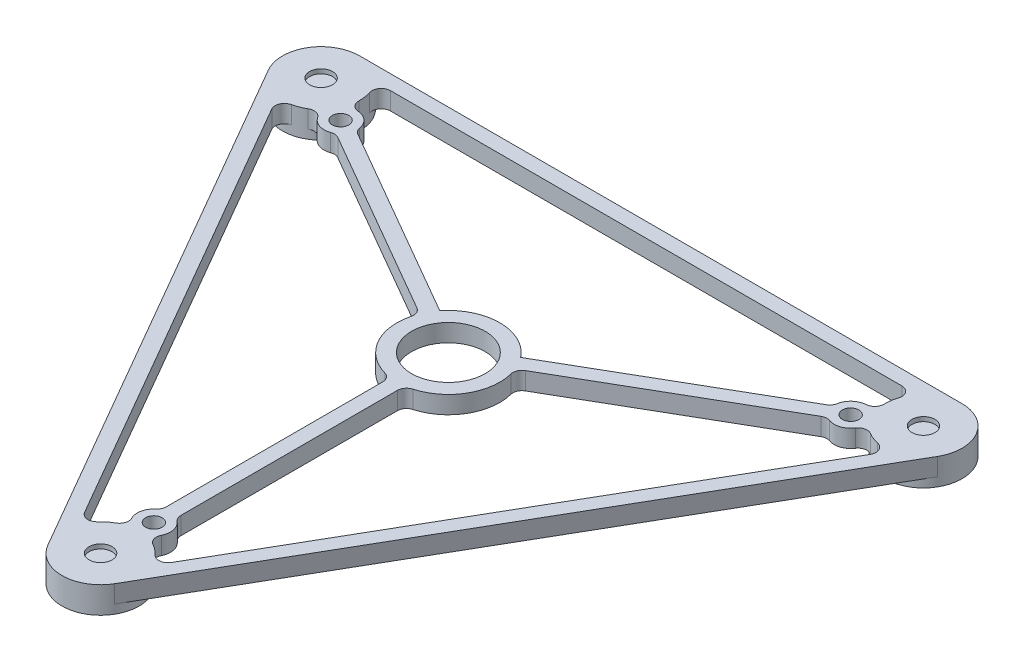
from build123d import *

# Parameters (mm, degrees)
SKETCH6_R           = 2.6
SKETCH6_R_2         = 4
BOSS_EXTRUDE4_DEPTH = 1.92
BOSS_EXTRUDE5_START = -0.96
SKETCH7_R           = 2.6
BOSS_EXTRUDE5_DEPTH = 0.96
BOSS_EXTRUDE6_START = 0.96
SKETCH8_R           = 4.2
SKETCH8_R_2         = 2.6
BOSS_EXTRUDE6_DEPTH = 0.96
CUT_EXTRUDE1_START  = -0.48
SKETCH9_R           = 1.25
CUT_EXTRUDE1_DEPTH  = 1
SKETCH15_R          = 1.8
SKETCH15_R_2        = 0.9
BOSS_EXTRUDE9_DEPTH = 1.92
SKETCH16_R          = 0.9
CUT_EXTRUDE2_DEPTH  = 110.391782763
FILLET4_R           = 1
FILLET5_R           = 1
FILLET6_R           = 1
FILLET7_R           = 1
FILLET8_R           = 1
FILLET9_R           = 1
FILLET10_R          = 1


with BuildPart() as part:
    # Sketch6 → Boss-Extrude4 (new body)
    with BuildSketch(Plane(origin=(6.205374015, -22.036704958, -3.582674358), x_dir=(-0.6546536707079775, 0, -0.7559289460184543), z_dir=(0, 1, 0))):
        with BuildLine():
            Line((-13.915641084, 5.595994683), (-78.289506975, 17.98475095))
            ThreePointArc((-78.289506975, 17.98475095), (-82.258133941, 16.609978241), (-83.051859334, 12.485660116))
            Line((-83.051859334, 12.485660116), (-61.593904038, -49.458121219))
            ThreePointArc((-61.593904038, -49.458121219), (-58.419002464, -52.207666636), (-54.450375498, -50.832893927))
            Line((-54.450375498, -50.832893927), (-11.534464904, -1.27786886))
            ThreePointArc((-11.534464904, -1.27786886), (-10.740739511, 2.846449266), (-13.915641084, 5.595994683))
        make_face()
        with BuildLine():
            Line((-61.161728639, -45.817623392), (-80.460318949, 9.892608162))
            ThreePointArc((-80.460318949, 9.892608162), (-78.390537961, 9.717948731), (-76.490180415, 10.556483435))
            Line((-76.490180415, 10.556483435), (-55.186131734, -7.893363926))
            ThreePointArc((-55.186131734, -7.893363926), (-55.764127927, -12.750109988), (-52.305655583, -16.208582332))
            Line((-52.305655583, -16.208582332), (-57.631667753, -43.883353372))
            ThreePointArc((-57.631667753, -43.883353372), (-59.643514651, -44.400046042), (-61.161728639, -45.817623392))
        make_face(mode=Mode.SUBTRACT)
        with BuildLine():
            Line((-54.138685861, -6.683877612), (-75.442734541, 11.765969748))
            ThreePointArc((-75.442734541, 11.765969748), (-74.884280071, 13.766626605), (-75.352831074, 15.790227162))
            Line((-75.352831074, 15.790227162), (-17.457060141, 4.648180851))
            ThreePointArc((-17.457060141, 4.648180851), (-18.64321014, 2.943027651), (-18.867196558, 0.878002387))
            Line((-18.867196558, 0.878002387), (-45.497257408, -8.346921293))
            ThreePointArc((-45.497257408, -8.346921293), (-49.414324781, -5.417988876), (-54.138685861, -6.683877612))
        make_face(mode=Mode.SUBTRACT)
        with BuildLine():
            ThreePointArc((-18.343473621, -0.633855505), (-16.890081194, -2.117819692), (-14.903316204, -2.723842899))
            Line((-14.903316204, -2.723842899), (-53.500496825, -47.292028142))
            ThreePointArc((-53.500496825, -47.292028142), (-54.384127815, -45.412215511), (-56.060498944, -44.185724951))
            Line((-56.060498944, -44.185724951), (-50.734486774, -16.51095391))
            ThreePointArc((-50.734486774, -16.51095391), (-46.239423208, -14.583140266), (-44.973534471, -9.858779185))
            Line((-44.973534471, -9.858779185), (-18.343473621, -0.633855505))
        make_face(mode=Mode.SUBTRACT)
        with Locations(Location((-79.083232368, 13.860432824, 0), (0, 0, 139.106605351))):
            Circle(SKETCH6_R, mode=Mode.SUBTRACT)
        with Locations(Location((-57.625277071, -48.08334851, 0), (0, 0, 139.106605351))):
            Circle(SKETCH6_R, mode=Mode.SUBTRACT)
        with Locations(Location((-14.709366477, 1.471676557, 0), (0, 0, 139.106605351))):
            Circle(SKETCH6_R, mode=Mode.SUBTRACT)
        with Locations(Location((-50.472625305, -10.91707971, 0), (0, 0, 139.106605351))):
            Circle(SKETCH6_R_2, mode=Mode.SUBTRACT)
    extrude(amount=BOSS_EXTRUDE4_DEPTH)

    # Sketch7 → Boss-Extrude5 (add)
    with BuildSketch(Plane(origin=(0, -20.116704958, 0), x_dir=(1, 0, 0), z_dir=(0, 1, 0)).offset(BOSS_EXTRUDE5_START)):
        with Locations(Location((47.5, -65.27241336, 0), (0, 0, 270))):
            Circle(SKETCH7_R)
        with Locations(Location((14.722431864, -8.5, 0), (0, 0, 270))):
            Circle(SKETCH7_R)
        with Locations(Location((80.277568136, -8.5, 0), (0, 0, 270))):
            Circle(SKETCH7_R)
    extrude(amount=BOSS_EXTRUDE5_DEPTH)

    # Sketch8 → Boss-Extrude6 (add)
    # profile 1 of 3: a face of its own
    with BuildSketch(Plane.XZ.offset(22.036704958).offset(BOSS_EXTRUDE6_START)):
        with Locations(Location((47.5, 65.27241336, 0), (0, 0, 270))):
            Circle(SKETCH8_R)
        with Locations(Location((47.5, 65.27241336, 0), (0, 0, 270))):
            Circle(SKETCH8_R_2, mode=Mode.SUBTRACT)
    # profile 2 of 3: a face of its own
    with BuildSketch(Plane.XZ.offset(22.036704958).offset(BOSS_EXTRUDE6_START)):
        with Locations(Location((80.277568136, 8.5, 0), (0, 0, 270))):
            Circle(SKETCH8_R)
        with Locations(Location((80.277568136, 8.5, 0), (0, 0, 270))):
            Circle(SKETCH8_R_2, mode=Mode.SUBTRACT)
    # profile 3 of 3: a face of its own
    with BuildSketch(Plane.XZ.offset(22.036704958).offset(BOSS_EXTRUDE6_START)):
        with Locations(Location((14.722431864, 8.5, 0), (0, 0, 270))):
            Circle(SKETCH8_R)
        with Locations(Location((14.722431864, 8.5, 0), (0, 0, 270))):
            Circle(SKETCH8_R_2, mode=Mode.SUBTRACT)
    extrude(amount=-BOSS_EXTRUDE6_DEPTH)

    # Sketch9 → Cut-Extrude1 (cut)
    with BuildSketch(Plane.XZ.offset(21.076704958).offset(CUT_EXTRUDE1_START)):
        with Locations(Location((14.722431864, 8.5, 0), (0, 0, 270))):
            Circle(SKETCH9_R)
        with Locations(Location((47.5, 65.27241336, 0), (0, 0, 270))):
            Circle(SKETCH9_R)
        with Locations(Location((80.277568136, 8.5, 0), (0, 0, 270))):
            Circle(SKETCH9_R)
    extrude(amount=-CUT_EXTRUDE1_DEPTH, mode=Mode.SUBTRACT)

    # Sketch15 → Boss-Extrude9 (add)
    # profile 1 of 3: a face of its own
    with BuildSketch(Plane.XZ.offset(22.036704958)):
        with Locations((19.745379206, 11.4)):
            Circle(SKETCH15_R)
        with Locations((19.745379206, 11.4)):
            Circle(SKETCH15_R_2, mode=Mode.SUBTRACT)
    # profile 2 of 3: a face of its own
    with BuildSketch(Plane.XZ.offset(22.036704958)):
        with Locations((47.5, 59.47241336)):
            Circle(SKETCH15_R)
        with Locations((47.5, 59.47241336)):
            Circle(SKETCH15_R_2, mode=Mode.SUBTRACT)
    # profile 3 of 3: a face of its own
    with BuildSketch(Plane.XZ.offset(22.036704958)):
        with Locations((75.254620794, 11.4)):
            Circle(SKETCH15_R)
        with Locations((75.254620794, 11.4)):
            Circle(SKETCH15_R_2, mode=Mode.SUBTRACT)
    extrude(amount=-BOSS_EXTRUDE9_DEPTH)

    # Sketch16 → Cut-Extrude2 (cut, through all)
    with BuildSketch(Plane.XZ.offset(22.036704958)):
        with Locations(Location((19.745379206, 11.4, 0), (0, 0, 270))):
            Circle(SKETCH16_R)
        with Locations(Location((47.5, 59.47241336, 0), (0, 0, 270))):
            Circle(SKETCH16_R)
        with Locations(Location((75.254620794, 11.4, 0), (0, 0, 270))):
            Circle(SKETCH16_R)
    extrude(amount=-CUT_EXTRUDE2_DEPTH, mode=Mode.SUBTRACT)

    # Fillet4
    # the kernel refuses this fillet: 1 mm, written as the material it adds along each edge
    with BuildSketch(Plane(origin=(46.7, -20.116704958, 57.85996181), x_dir=(-0.8367977565888843, 0, 0.5475121136265482), z_dir=(0, -1, 0)), Plane(origin=(21.541803211, -20.116704958, 11.513405452), x_dir=(-0.05576052098568756, 0, -0.9984441718490847), z_dir=(0, -1, 0)), Plane(origin=(74.258196789, -20.116704958, 12.899046098), x_dir=(0.8925582775748443, 0, 0.45093205822233046), z_dir=(0, -1, 0))) as fillet4_piece_1:
        with BuildLine():
            CenterArc((0.545351852, 0.992947517), FILLET4_R, 213.196500423, 49.994799115)
            Line((-0.291445905, 0.445435403), (0, 0))
            ThreePointArc((0, 0), (0.213398551, 0.01269447), (0.426797102, 0))
        make_face()
    extrude(amount=1.92)
    with BuildSketch(Plane(origin=(48.3, -20.116704958, 57.85996181), x_dir=(0.8367977565890745, 0, 0.5475121136262574), z_dir=(0, -1, 0)), Plane(origin=(20.741803211, -20.116704958, 12.899046098), x_dir=(-0.8925582775746639, 0, 0.4509320582226875), z_dir=(0, -1, 0)), Plane(origin=(73.458196789, -20.116704958, 11.513405452), x_dir=(0.055760520985286104, 0, -0.9984441718491072), z_dir=(0, -1, 0))) as fillet4_piece_2:
        with BuildLine():
            CenterArc((0.545351852, -0.992947517), FILLET4_R, 96.808700462, 49.994799115)
            Line((-0.291445905, -0.445435403), (0, 0))
            ThreePointArc((0, 0), (0.213398551, -0.01269447), (0.426797102, 0))
        make_face()
    extrude(amount=1.92)
    with BuildSketch(Plane(origin=(48.3, -22.036704958, 32.966700371), x_dir=(0, 0, 1), z_dir=(0, 1, 0)), Plane(origin=(42.3, -22.036704958, 25.345676817), x_dir=(-0.8660254037844427, 0, -0.4999999999999931), z_dir=(0, 1, 0))) as fillet4_piece_3:
        with BuildLine():
            CenterArc((0.807240562, 1), FILLET4_R, 195.826620132, 74.173379868)
            ThreePointArc((-0.154850824, 0.727272727), (-0.065341051, 0.366209364), (0, 0))
            Line((0, 0), (0.807240562, 0))
        make_face()
    extrude(amount=1.92)
    with BuildSketch(Plane(origin=(51.4009083, -22.036704958, 63.715841988), x_dir=(-0.5286840359966489, 0, -0.8488187027170727), z_dir=(0, 1, 0)), Plane(origin=(76.979083635, -22.036704958, 5.9), x_dir=(-0.47075654176194004, 0, 0.8822631571069591), z_dir=(0, 1, 0))) as fillet4_piece_4:
        with BuildLine():
            CenterArc((1.658654735, -0.984309133), FILLET4_R, 100.163203369, 107.920213139)
            Line((0.776391578, -1.455065675), (0, 0))
            ThreePointArc((0, 0), (0.741101052, -0.065901642), (1.482202104, 0))
        make_face()
    extrude(amount=1.92)
    with BuildSketch(Plane(origin=(80.879991935, -22.036704958, 12.656571371), x_dir=(-0.5000000000000111, 0, 0.8660254037844322), z_dir=(0, 1, 0)), Plane(origin=(43.5990917, -22.036704958, 63.715841988), x_dir=(-0.5000000000000028, 0, -0.8660254037844369), z_dir=(0, 1, 0)), Plane(origin=(18.020916365, -22.036704958, 5.9), x_dir=(1, 0, 0), z_dir=(0, 1, 0))) as fillet4_piece_5:
        with BuildLine():
            CenterArc((1.64924225, -1), FILLET4_R, 90, 107.920213139)
            ThreePointArc((0.697756337, -1.307692308), (0.407020759, -0.622822525), (0, 0))
            Line((0, 0), (1.64924225, 0))
        make_face()
    extrude(amount=1.92)
    with BuildSketch(Plane(origin=(52.7, -22.036704958, 25.345676817), x_dir=(0.8660254037844392, 0, -0.49999999999999917), z_dir=(0, 1, 0)), Plane(origin=(46.7, -22.036704958, 32.966700371), x_dir=(0, 0, 1), z_dir=(0, 1, 0))) as fillet4_piece_6:
        with BuildLine():
            CenterArc((0.807240562, -1), FILLET4_R, 90, 74.173379868)
            ThreePointArc((-0.154850824, -0.727272727), (-0.065341051, -0.366209364), (0, 0))
            Line((0, 0), (0.807240562, 0))
        make_face()
    extrude(amount=1.92)
    with BuildSketch(Plane(origin=(14.120008065, -22.036704958, 12.656571371), x_dir=(0.499999999999999, 0, 0.8660254037844392), z_dir=(0, 1, 0))) as fillet4_piece_7:
        with BuildLine():
            CenterArc((1.64924225, 1), FILLET4_R, 162.079786861, 107.920213139)
            ThreePointArc((0.697756337, 1.307692308), (0.407020759, 0.622822525), (0, 0))
            Line((0, 0), (1.64924225, 0))
        make_face()
    extrude(amount=1.92)

    # Fillet5
    # the kernel refuses this fillet: 1 mm, written as the material it adds along each edge
    with BuildSketch(Plane(origin=(17.948955202, -20.116704958, 11.286594548), x_dir=(-0.7936286063896545, 0, 0.6084025272136984), z_dir=(0, -1, 0))) as fillet5_piece_1:
        with BuildLine():
            CenterArc((1.436915896, -0.993939548), FILLET5_R, 96.311167786, 87.559469258)
            Line((0.439196892, -1.061443536), (0.339424992, -1.068193935))
            ThreePointArc((0.339424992, -1.068193935), (0.214142343, -0.532979357), (-0.075372073, -0.065719484))
            Line((-0.075372073, -0.065719484), (-0.092370635, 0.038310127))
            ThreePointArc((-0.092370635, 0.038310127), (0.04470246, 0.157502909), (1.315995045, 0.099393955))
            Line((1.315995045, 0.099393955), (1.32698785, 0))
        make_face()
    extrude(amount=1.92)
    with BuildSketch(Plane(origin=(17.893146079, -22.036704958, 11.254373136), x_dir=(-0.7650206510396939, 0, 0.6440057480200025), z_dir=(0, 1, 0))) as fillet5_piece_2:
        with BuildLine():
            CenterArc((1.458856994, 0.987883455), FILLET5_R, 173.512276912, 87.559469258)
            Line((0.465260905, 1.100873771), (0.365901296, 1.112172802))
            ThreePointArc((0.365901296, 1.112172802), (-0.094237007, 0.129683936), (-0.094023566, -0.034052444))
            Line((-0.094023566, -0.034052444), (0.015519755, -0.098788345))
            ThreePointArc((0.015519755, -0.098788345), (0.651829721, -0.049110509), (1.288139686, -0.098788345))
            Line((1.288139686, -0.098788345), (1.303659442, 0))
        make_face()
    extrude(amount=1.92)

    # Fillet6
    # the kernel refuses this fillet: 1 mm, written as the material it adds along each edge
    with BuildSketch(Plane(origin=(18.748955202, -20.116704958, 9.900953902), x_dir=(0.9659060551414003, 0, -0.25889282076021003), z_dir=(0, -1, 0))) as fillet6_piece_1:
        with BuildLine():
            CenterArc((1.467808139, -0.947724847), FILLET6_R, 108.607823847, 87.559469258)
            Line((0.50735535, -1.22616773), (0.411310071, -1.254012019))
            ThreePointArc((0.411310071, -1.254012019), (-0.128444999, -0.101525163), (-0.070716079, 0.070705277))
            Line((-0.070716079, 0.070705277), (0.031908873, 0.094772485))
            ThreePointArc((0.031908873, 0.094772485), (0.574359707, 0.005904724), (1.116810541, 0.094772485))
            Line((1.116810541, 0.094772485), (1.148719413, 0))
        make_face()
    extrude(amount=1.92)
    with BuildSketch(Plane(origin=(18.693146079, -22.036704958, 9.86873249), x_dir=(0.17521501244867502, 0, -0.9845301922300863), z_dir=(0, 1, 0))) as fillet6_piece_2:
        with BuildLine():
            CenterArc((1.458856994, -0.987883455), FILLET6_R, 98.92825383, 87.559469258)
            Line((0.465260905, -1.100873771), (0.365901296, -1.112172802))
            ThreePointArc((0.365901296, -1.112172802), (-0.094237007, -0.129683936), (-0.094023566, 0.034052444))
            Line((-0.094023566, 0.034052444), (0.015519755, 0.098788345))
            ThreePointArc((0.015519755, 0.098788345), (0.651829721, 0.049110509), (1.288139686, 0.098788345))
            Line((1.288139686, 0.098788345), (1.303659442, 0))
        make_face()
    extrude(amount=1.92)

    # Fillet7
    # the kernel refuses this fillet: 1 mm, written as the material it adds along each edge
    with BuildSketch(Plane(origin=(76.251044798, -20.116704958, 9.900953902), x_dir=(-0.9659060551413163, 0, -0.258892820760523), z_dir=(0, -1, 0))) as fillet7_piece_1:
        with BuildLine():
            CenterArc((1.467808139, 0.947724847), FILLET7_R, 163.832706895, 87.559469258)
            Line((0.50735535, 1.22616773), (0.411310071, 1.254012019))
            ThreePointArc((0.411310071, 1.254012019), (-0.128444999, 0.101525163), (-0.070716079, -0.070705277))
            Line((-0.070716079, -0.070705277), (0.031908873, -0.094772485))
            ThreePointArc((0.031908873, -0.094772485), (0.574359707, -0.005904724), (1.116810541, -0.094772485))
            Line((1.116810541, -0.094772485), (1.148719413, 0))
        make_face()
    extrude(amount=1.92)
    with BuildSketch(Plane(origin=(76.306853921, -22.036704958, 9.86873249), x_dir=(-0.9750752661926074, 0, -0.22187434565405648), z_dir=(0, 1, 0))) as fillet7_piece_2:
        with BuildLine():
            CenterArc((1.47787276, -0.959202562), FILLET7_R, 106.422593877, 87.559469258)
            Line((0.507501346, -1.200820688), (0.410464204, -1.2249825))
            ThreePointArc((0.410464204, -1.2249825), (0.208514231, -0.619528565), (-0.084953776, -0.052752781))
            Line((-0.084953776, -0.052752781), (-0.067968645, 0.073350278))
            ThreePointArc((-0.067968645, 0.073350278), (0.082768354, 0.137287787), (1.166881058, 0.095920256))
            Line((1.166881058, 0.095920256), (1.195153031, 0))
        make_face()
    extrude(amount=1.92)

    # Fillet8
    # the kernel refuses this fillet: 1 mm, written as the material it adds along each edge
    with BuildSketch(Plane(origin=(77.051044798, -20.116704958, 11.286594548), x_dir=(-0.25874526793525154, 0, 0.9659455918016887), z_dir=(0, -1, 0))) as fillet8_piece_1:
        with BuildLine():
            CenterArc((1.467808139, -0.947724847), FILLET8_R, 108.607823847, 87.559469258)
            Line((0.50735535, -1.22616773), (0.411310071, -1.254012019))
            ThreePointArc((0.411310071, -1.254012019), (-0.128444999, -0.101525163), (-0.070716079, 0.070705277))
            Line((-0.070716079, 0.070705277), (0.031908873, 0.094772485))
            ThreePointArc((0.031908873, 0.094772485), (0.574359707, 0.005904724), (1.116810541, 0.094772485))
            Line((1.116810541, 0.094772485), (1.148719413, 0))
        make_face()
    extrude(amount=1.92)
    with BuildSketch(Plane(origin=(77.106853921, -22.036704958, 11.254373136), x_dir=(0.7650206510396409, 0, 0.6440057480200654), z_dir=(0, 1, 0))) as fillet8_piece_2:
        with BuildLine():
            CenterArc((1.458856994, -0.987883455), FILLET8_R, 98.92825383, 87.559469258)
            Line((0.465260905, -1.100873771), (0.365901296, -1.112172802))
            ThreePointArc((0.365901296, -1.112172802), (-0.094237007, -0.129683936), (-0.094023566, 0.034052444))
            Line((-0.094023566, 0.034052444), (0.015519755, 0.098788345))
            ThreePointArc((0.015519755, 0.098788345), (0.651829721, 0.049110509), (1.288139686, 0.098788345))
            Line((1.288139686, 0.098788345), (1.303659442, 0))
        make_face()
    extrude(amount=1.92)

    # Fillet9
    # the kernel refuses this fillet: 1 mm, written as the material it adds along each edge
    with BuildSketch(Plane(origin=(48.3, -20.116704958, 61.084864909), x_dir=(0.7071607872065585, 0, -0.7070527710414553), z_dir=(0, -1, 0))) as fillet9_piece_1:
        with BuildLine():
            CenterArc((1.467808139, 0.947724847), FILLET9_R, 163.832706895, 87.559469258)
            Line((0.50735535, 1.22616773), (0.411310071, 1.254012019))
            ThreePointArc((0.411310071, 1.254012019), (-0.128444999, 0.101525163), (-0.070716079, -0.070705277))
            Line((-0.070716079, -0.070705277), (0.031908873, -0.094772485))
            ThreePointArc((0.031908873, -0.094772485), (0.574359707, -0.005904724), (1.116810541, -0.094772485))
            Line((1.116810541, -0.094772485), (1.148719413, 0))
        make_face()
    extrude(amount=1.92)
    with BuildSketch(Plane(origin=(48.3, -22.036704958, 61.149307734), x_dir=(0.6796864528804881, 0, -0.7335027782979013), z_dir=(0, 1, 0))) as fillet9_piece_2:
        with BuildLine():
            CenterArc((1.47787276, -0.959202562), FILLET9_R, 106.422593877, 87.559469258)
            Line((0.507501346, -1.200820688), (0.410464204, -1.2249825))
            ThreePointArc((0.410464204, -1.2249825), (0.208514231, -0.619528565), (-0.084953776, -0.052752781))
            Line((-0.084953776, -0.052752781), (-0.067968645, 0.073350278))
            ThreePointArc((-0.067968645, 0.073350278), (0.082768354, 0.137287787), (1.166881058, 0.095920256))
            Line((1.166881058, 0.095920256), (1.195153031, 0))
        make_face()
    extrude(amount=1.92)

    # Fillet10
    # the kernel refuses this fillet: 1 mm, written as the material it adds along each edge
    with BuildSketch(Plane(origin=(46.7, -20.116704958, 61.084864909), x_dir=(-0.7071607872063822, 0, -0.7070527710416314), z_dir=(0, -1, 0))) as fillet10_piece_1:
        with BuildLine():
            CenterArc((1.467808139, -0.947724847), FILLET10_R, 108.607823847, 87.559469258)
            Line((0.50735535, -1.22616773), (0.411310071, -1.254012019))
            ThreePointArc((0.411310071, -1.254012019), (-0.128444999, -0.101525163), (-0.070716079, 0.070705277))
            Line((-0.070716079, 0.070705277), (0.031908873, 0.094772485))
            ThreePointArc((0.031908873, 0.094772485), (0.574359707, 0.005904724), (1.116810541, 0.094772485))
            Line((1.116810541, 0.094772485), (1.148719413, 0))
        make_face()
    extrude(amount=1.92)
    with BuildSketch(Plane(origin=(46.7, -22.036704958, 61.149307734), x_dir=(-0.9402356634883816, 0, 0.3405244442100488), z_dir=(0, 1, 0))) as fillet10_piece_2:
        with BuildLine():
            CenterArc((1.458856994, -0.987883455), FILLET10_R, 98.92825383, 87.559469258)
            Line((0.465260905, -1.100873771), (0.365901296, -1.112172802))
            ThreePointArc((0.365901296, -1.112172802), (-0.094237007, -0.129683936), (-0.094023566, 0.034052444))
            Line((-0.094023566, 0.034052444), (0.015519755, 0.098788345))
            ThreePointArc((0.015519755, 0.098788345), (0.651829721, 0.049110509), (1.288139686, 0.098788345))
            Line((1.288139686, 0.098788345), (1.303659442, 0))
        make_face()
    extrude(amount=1.92)


solid = part.part
